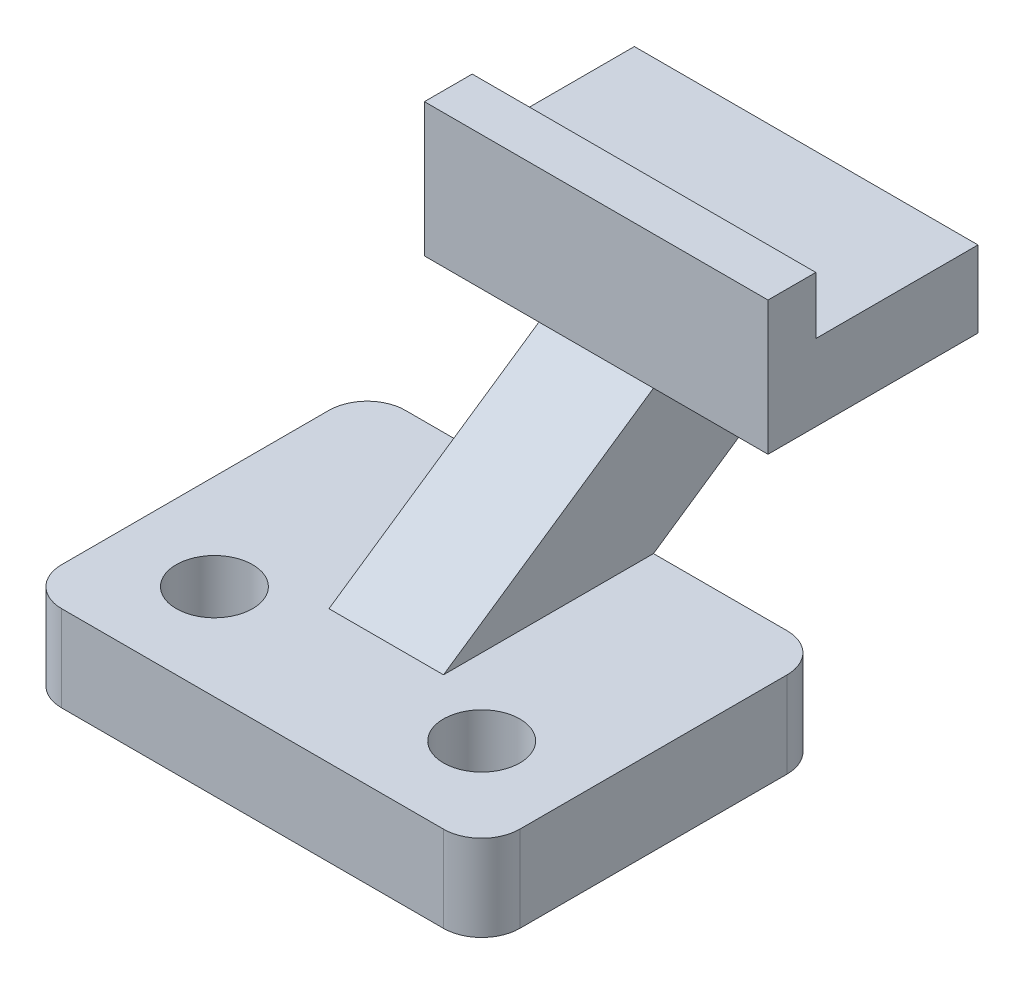
from build123d import *

# Parameters (mm, degrees)
SKETCH1_R               = 6.35
SKETCH1_W               = 19.05
SKETCH1_H               = 25.985863096
EXTRUDE2_DEPTH          = 14.3002
SKETCH2_W               = 19.05
SKETCH2_H               = 69.85
EXTRUDE3_DEPTH          = 23.8252
CUT_EXTRUDE1_DEPTH      = 73.599512703
CUT_EXTRUDE1_DEPTH_BACK = 73.599512703
CUT_EXTRUDE2_START      = -19.05
CUT_EXTRUDE2_DEPTH      = 19.05
EXTRUDE4_DEPTH          = 19.05
EXTRUDE4_DEPTH_BACK     = 38.1
FILLET1_R               = 6.35


# Read off the part's stored shape, not the designer's step: Cut-Extrude2
with BuildPart() as part:
    # Sketch1 → Extrude2 (new body)
    # profile 1 of 2: a face of its own
    with BuildSketch(Plane(origin=(0, 0, 0), x_dir=(1, 0, 0), z_dir=(0, 1, 0))):
        Polygon((-44.03422619, -11.566071429), (-44.03422619, 14.419791667), (-72.60922619, 14.419791667), (-72.60922619, -42.730208333), (3.59077381, -42.730208333), (3.59077381, 14.419791667), (-24.98422619, 14.419791667), (-24.98422619, -11.566071429), align=None)
        with Locations(Location((-56.73422619, -26.855208333, 0), (0, 0, 270))):
            Circle(SKETCH1_R, mode=Mode.SUBTRACT)
        with Locations(Location((-12.28422619, -26.855208333, 0), (0, 0, 270))):
            Circle(SKETCH1_R, mode=Mode.SUBTRACT)
    # profile 2 of 2: a face of its own
    with BuildSketch(Plane(origin=(0, 0, 0), x_dir=(1, 0, 0), z_dir=(0, 1, 0))):
        with Locations((-34.50922619, 1.426860119)):
            Rectangle(SKETCH1_W, SKETCH1_H)
    extrude(amount=-EXTRUDE2_DEPTH)

    # Sketch2 → Extrude3 (add)
    with BuildSketch(Plane(origin=(0, 0, 0), x_dir=(-1, 0, 0), z_dir=(0, 1, 0))):
        with Locations((34.50922619, -14.419791667)):
            Rectangle(SKETCH2_W, SKETCH2_H)
    extrude(amount=EXTRUDE3_DEPTH)

    # Sketch3 → Cut-Extrude1 (cut, two sides: drawn at the far end of the back side and taken through both)
    with BuildSketch(Plane.ZY.offset(44.03422619).offset(-CUT_EXTRUDE1_DEPTH_BACK)):
        Polygon((20.505208333, 23.8252), (-14.419791667, 23.8252), (20.505208333, 0), align=None)
    extrude(amount=CUT_EXTRUDE1_DEPTH + CUT_EXTRUDE1_DEPTH_BACK, mode=Mode.SUBTRACT)

    # Cut-Extrude2 outline → Cut-Extrude2 (cut)
    with BuildSketch(Plane.ZY.offset(44.03422619).offset(CUT_EXTRUDE2_START)):
        Polygon((-49.344791667, 0), (-14.419791667, 0), (-49.344791667, 23.8252), align=None)
    extrude(amount=CUT_EXTRUDE2_DEPTH, mode=Mode.SUBTRACT)

    # Sketch5 → Extrude4 (add, two sides: drawn at the far end of the back side and taken through both)
    with BuildSketch(Plane(origin=(-24.98422619, 0, -14.419791667), x_dir=(0, 0, -1), z_dir=(1, 0, 0)).offset(-EXTRUDE4_DEPTH_BACK)):
        Polygon((0, 23.8252), (0, 46.0502), (7.9502, 46.0502), (7.9502, 36.5252), (34.925, 36.5252), (34.925, 23.8252), align=None)
    extrude(amount=EXTRUDE4_DEPTH + EXTRUDE4_DEPTH_BACK)

    # Fillet1
    fillet1_edges = [part.edges().sort_by_distance(p)[0] for p in [
        (3.59077381, -7.1501, 42.730208333),
        (-72.60922619, -7.1501, 42.730208333),
        (-72.60922619, -7.1501, -14.419791667),
        (3.59077381, -7.1501, -14.419791667),
    ]]
    fillet(fillet1_edges, radius=FILLET1_R)


solid = part.part
